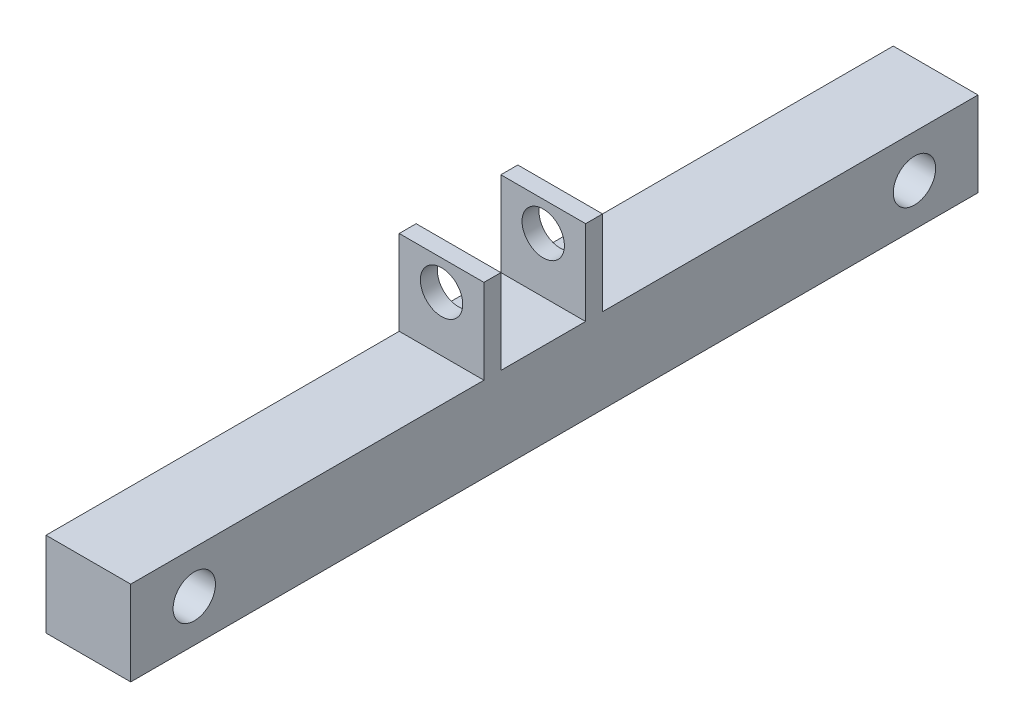
from build123d import *

# Parameters (mm, degrees)
SKETCH1_W           = 20
SKETCH1_H           = 20
BOSS_EXTRUDE1_DEPTH = 200
SKETCH3_R           = 5
CUT_EXTRUDE1_DEPTH  = 57
SKETCH4_W           = 20
SKETCH4_H           = 4
BOSS_EXTRUDE2_DEPTH = 20
SKETCH5_R           = 5
CUT_EXTRUDE2_DEPTH  = 49


with BuildPart() as part:
    # Sketch1 → Boss-Extrude1 (new body)
    with BuildSketch(Plane.XY):
        Rectangle(SKETCH1_W, SKETCH1_H)
    extrude(amount=BOSS_EXTRUDE1_DEPTH)

    # Sketch3 → Cut-Extrude1 (cut)
    with BuildSketch(Plane.ZY.offset(10)):
        with Locations((15, 0)):
            Circle(SKETCH3_R)
        with Locations((185, 0)):
            Circle(SKETCH3_R)
    extrude(amount=-CUT_EXTRUDE1_DEPTH, mode=Mode.SUBTRACT)

    # Sketch4 → Boss-Extrude2 (add)
    with BuildSketch(Plane(origin=(0, 10, 0), x_dir=(1, 0, 0), z_dir=(0, 1, 0))):
        with Locations((0, -90.625901795)):
            Rectangle(SKETCH4_W, SKETCH4_H)
        with Locations((0, -114.625901795)):
            Rectangle(SKETCH4_W, SKETCH4_H)
    extrude(amount=BOSS_EXTRUDE2_DEPTH)

    # Sketch5 → Cut-Extrude2 (cut)
    with BuildSketch(Plane(origin=(0, 0, 88.625901795), x_dir=(-1, 0, 0), z_dir=(0, 0, -1))):
        with Locations((0, 23)):
            Circle(SKETCH5_R)
    extrude(amount=-CUT_EXTRUDE2_DEPTH, mode=Mode.SUBTRACT)


solid = part.part
